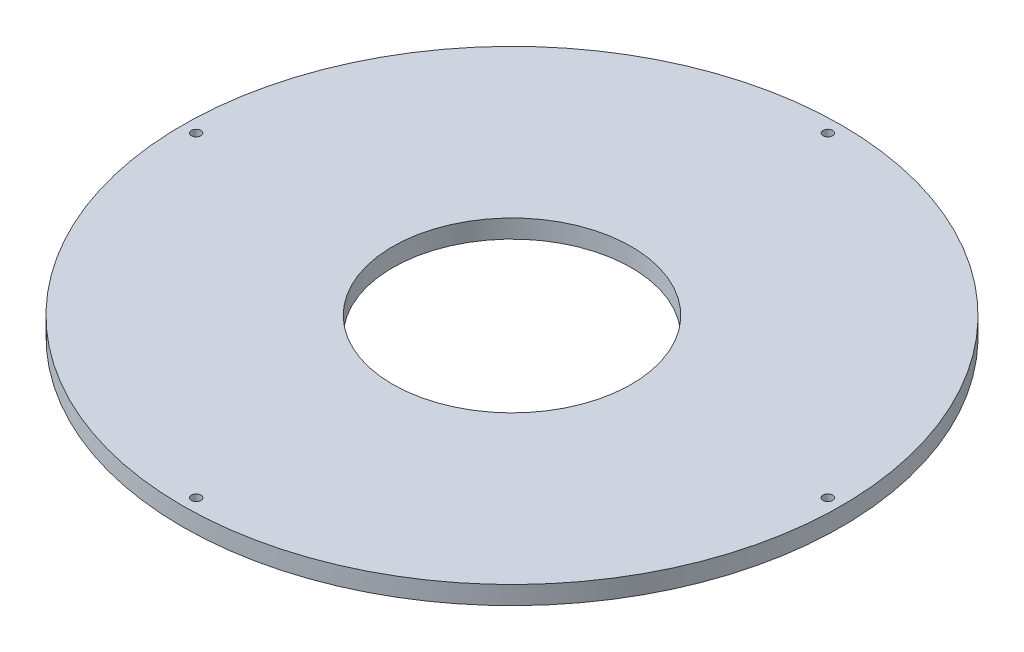
from build123d import *

# Parameters (mm, degrees)
SKETCH1_R             = 114.3
SKETCH1_R_2           = 41.402
BOSS_EXTRUDE1_DEPTH   = 6.35
F_4_CLEARANCE_HOLE1_D = 3.2639


with BuildPart() as part:
    # Sketch1 → Boss-Extrude1 (new body)
    with BuildSketch(Plane(origin=(0, 0, 0), x_dir=(1, 0, 0), z_dir=(0, 1, 0))):
        Circle(SKETCH1_R)
        Circle(SKETCH1_R_2, mode=Mode.SUBTRACT)
    extrude(amount=BOSS_EXTRUDE1_DEPTH)

    # #4 Clearance Hole1 (through all)
    with Locations(Plane(origin=(0, 6.35, 0), x_dir=(1, 0, 0), z_dir=(0, 1, 0))):
        with Locations((0, 109.5375), (109.5375, 0), (0, -109.5375), (-109.5375, 0)):
            Hole(F_4_CLEARANCE_HOLE1_D / 2)


solid = part.part
